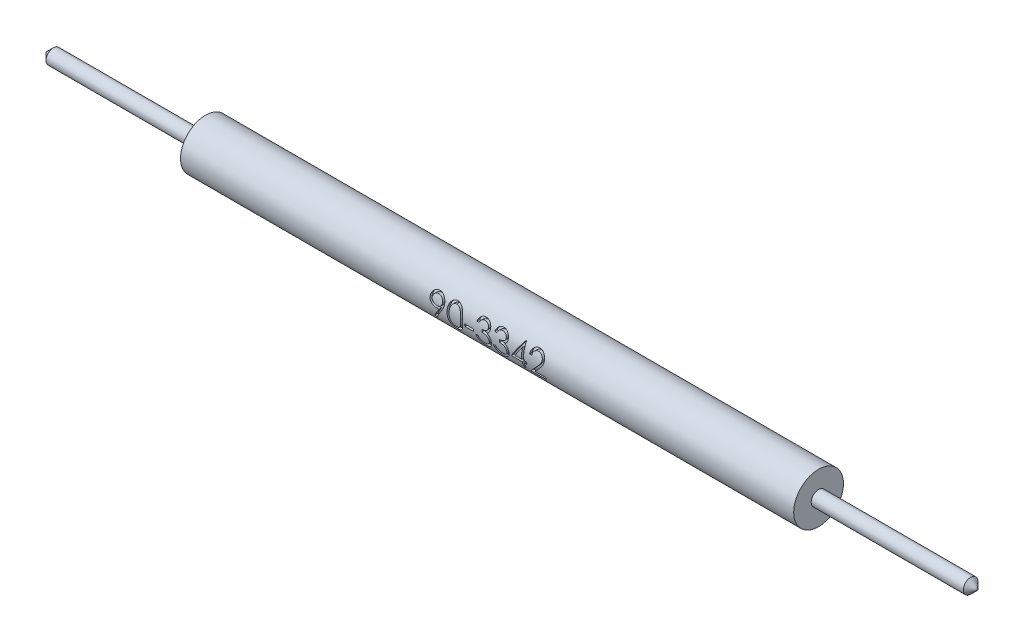
from build123d import *

# Parameters (mm, degrees)
CHAFL_N1_SIZE              = 0.762
CORTAR_EXTRUIR1_DEPTH      = 97.58883786
CORTAR_EXTRUIR1_DEPTH_BACK = 97.58883786
CROQUIS2_W                 = 25.4
CROQUIS2_H                 = 0.7366
ELIMINAR_START             = 35.56
ELIMINAR_CARA1_DEPTH       = 25.4
CORTAR_EXTRUIR2_REACH      = 104.939
CORTAR_EXTRUIR2_END_RADIUS = 2.3241
CORTAR_EXTRUIR2_START      = 6.35
CROQUIS3_W                 = 0.915865385
CROQUIS3_H                 = 0.244230769


# Read off the part's stored shape, not the designer's step: Eliminar cara1
with BuildPart() as part:
    # Croquis1 → Revolución1 (revolve)
    with BuildSketch(Plane.XY):
        Polygon((0, 0), (0, 0.762), (16.51, 0.762), (16.51, 2.5781), (80.01, 2.5781), (80.01, 0.762), (96.52, 0.762), (96.52, 0), align=None)
    revolve(axis=Axis((0, 0, 0), (-1, 0, 0)))

    # Chaflán1
    chafl_n1_edges = [part.edges().sort_by_distance(p)[0] for p in [
        (96.52, -0.762, 0),
        (0, -0.762, 0),
    ]]
    chamfer(chafl_n1_edges, length=CHAFL_N1_SIZE - 0.0001)  # a hair under: the kernel refuses the full size

    # Croquis2 → Cortar-Extruir1 (cut, two sides: drawn at the far end of the back side and taken through both)
    with BuildSketch(Plane(origin=(0, 0, 0), x_dir=(1, 0, 0), z_dir=(0, 1, 0)).offset(-CORTAR_EXTRUIR1_DEPTH_BACK)):
        with Locations((48.26, -2.2098)):
            Rectangle(CROQUIS2_W, CROQUIS2_H)
    extrude(amount=CORTAR_EXTRUIR1_DEPTH + CORTAR_EXTRUIR1_DEPTH_BACK, mode=Mode.SUBTRACT)

    # Eliminar cara1 outline → Eliminar cara1 (add)
    with BuildSketch(Plane.YZ.offset(ELIMINAR_START)):
        with BuildLine():
            Line((-1.804294145, 1.8415), (1.804294145, 1.8415))
            ThreePointArc((1.804294145, 1.8415), (0, 2.5781), (-1.804294145, 1.8415))
        make_face()
    extrude(amount=ELIMINAR_CARA1_DEPTH)

    # Cortar-Extruir2: up to this cylinder (the profile starts outside it)
    cortar_extruir2_end = Plane(origin=(47.7254675, 0, 0), z_dir=(1, 0, 0)) * Cylinder(CORTAR_EXTRUIR2_END_RADIUS, 225.532073, mode=Mode.PRIVATE)
    # Croquis3 → Cortar-Extruir2 (cut, up to the surface)
    with BuildSketch(Plane.XY.offset(CORTAR_EXTRUIR2_START), mode=Mode.PRIVATE) as cortar_extruir2_sk1:
        with BuildLine():
            Line((42.791264239, -1.230066931), (42.620493506, -1.111290639))
            Line((42.620493506, -1.111290639), (43.282587857, -0.143430814))
            add(Edge.make_bspline(
                [(43.282587857, -0.143430814), (43.240343981, -0.148596808), (43.157163435, -0.15876894), (43.073386229, -0.160637646), (43.032155916, -0.161557316)],
                knots=[0, 0, 0, 0, 1.015715272, 2, 2, 2, 2], degree=3))
            add(Edge.make_bspline(
                [(43.032155916, -0.161557316), (43.007158201, -0.160917048), (42.958089873, -0.159660258), (42.885950481, -0.149698599), (42.816631912, -0.134356458), (42.75031794, -0.111463287), (42.686759312, -0.08301197), (42.626094782, -0.04773068), (42.568406014, -0.006224614), (42.51431258, 0.04128676), (42.465114772, 0.093455221), (42.421283921, 0.148670042), (42.384856829, 0.207572622), (42.354596867, 0.268961397), (42.331648112, 0.333718709), (42.314936814, 0.401107676), (42.304648212, 0.471600596), (42.303424184, 0.519582873), (42.302802701, 0.543945238)],
                knots=[0, 0, 0, 0, 1.060718605, 2.082097864, 3.085795603, 4.069760067, 5.054557537, 6.03741023, 7.043284206, 8.066802108, 9.088538119, 10.083643548, 11.053783639, 12.022749082, 12.983451788, 13.964007469, 14.966251758, 16, 16, 16, 16], degree=3))
            add(Edge.make_bspline(
                [(42.302802701, 0.543945238), (42.303982736, 0.577261411), (42.306298905, 0.642654299), (42.324939682, 0.738199417), (42.355596806, 0.828541691), (42.398342541, 0.91344359), (42.452182414, 0.991683804), (42.516890222, 1.062174661), (42.592072384, 1.123913571), (42.676016222, 1.176984202), (42.766743902, 1.219666405), (42.861768471, 1.251125644), (42.960361828, 1.269630506), (43.027150903, 1.272070172), (43.060776709, 1.273298453)],
                knots=[0, 0, 0, 0, 1.022988612, 2.007919123, 2.978103895, 3.94594894, 4.918897164, 5.887013414, 6.875921846, 7.89917871, 8.930658928, 9.948724884, 10.967259574, 12, 12, 12, 12], degree=3))
            add(Edge.make_bspline(
                [(43.060776709, 1.273298453), (43.093766152, 1.272053289), (43.158950181, 1.269592961), (43.254805023, 1.251574404), (43.346613108, 1.221205524), (43.4338655, 1.179237991), (43.514650708, 1.126632159), (43.587296393, 1.063947778), (43.650144751, 0.991145803), (43.703092784, 0.909987027), (43.745594723, 0.822787705), (43.776259972, 0.731766858), (43.795136916, 0.637579085), (43.797515667, 0.573765345), (43.798716162, 0.541560172)],
                knots=[0, 0, 0, 0, 1.026385292, 2.028040595, 3.023318987, 4.028184125, 5.03290303, 6.015178782, 7.004435299, 8.016004309, 9.023023918, 10.015172535, 10.998308025, 12, 12, 12, 12], degree=3))
            add(Edge.make_bspline(
                [(43.798716162, 0.541560172), (43.797914423, 0.516561288), (43.796288296, 0.465857304), (43.78490163, 0.388820231), (43.765565754, 0.310272163), (43.743623081, 0.243786577), (43.722442088, 0.188876007), (43.702506854, 0.145502164), (43.680386978, 0.09984934), (43.654588675, 0.05239624), (43.626855755, 0.002537944), (43.595518998, -0.049225475), (43.561293242, -0.102963479), (43.536916237, -0.139190516), (43.52443356, -0.15774121)],
                knots=[0, 0, 0, 0, 1.179839688, 2.393009684, 3.667231171, 4.993948276, 5.694988576, 6.444077775, 7.246288328, 8.089075292, 8.993003841, 9.939041771, 10.944649915, 12, 12, 12, 12], degree=3))
            Line((43.52443356, -0.15774121), (42.791264239, -1.230066931))
        make_face()
        with BuildLine():
            add(Edge.make_bspline(
                [(43.071748013, 0.082673453), (43.090685084, 0.083190786), (43.127549122, 0.084197856), (43.181554034, 0.090327358), (43.232529251, 0.101195374), (43.28061094, 0.116788964), (43.326281207, 0.135605376), (43.368814638, 0.159562102), (43.408246828, 0.18814842), (43.444841829, 0.220268091), (43.477338407, 0.255953221), (43.506282862, 0.293302859), (43.530884962, 0.33248096), (43.550318192, 0.373978162), (43.56629609, 0.416784334), (43.577330131, 0.461588815), (43.583442686, 0.508158173), (43.584484704, 0.539793867), (43.585014239, 0.555870569)],
                knots=[0, 0, 0, 0, 1.163407946, 2.26475976, 3.333800367, 4.359385343, 5.366239384, 6.363380779, 7.350133999, 8.353570782, 9.349036268, 10.310270964, 11.253520213, 12.184142, 13.120487599, 14.056272588, 15.012232024, 16, 16, 16, 16], degree=3))
            add(Edge.make_bspline(
                [(43.585014239, 0.555870569), (43.584558625, 0.571953984), (43.583660781, 0.603648326), (43.576457636, 0.650286631), (43.563785833, 0.69498151), (43.546783378, 0.737977653), (43.524385859, 0.778921799), (43.49750938, 0.818327997), (43.465578553, 0.855946391), (43.428837521, 0.890892244), (43.389217227, 0.923105726), (43.346993922, 0.951535181), (43.302515631, 0.975362102), (43.256053709, 0.995023723), (43.20751135, 1.010366985), (43.156917279, 1.021400584), (43.104015834, 1.027504582), (43.068105709, 1.028540014), (43.049805405, 1.029067684)],
                knots=[0, 0, 0, 0, 0.972161553, 1.915763587, 2.844109794, 3.775983486, 4.705125789, 5.659731448, 6.655561913, 7.682237399, 8.721216875, 9.739758359, 10.754845918, 11.767244016, 12.7857855, 13.828538656, 14.893392813, 16, 16, 16, 16], degree=3))
            add(Edge.make_bspline(
                [(43.049805405, 1.029067684), (43.031664258, 1.028539161), (42.996071476, 1.027502203), (42.943640325, 1.021412187), (42.893388352, 1.010292781), (42.844986642, 0.99503083), (42.7985261, 0.975360636), (42.754049907, 0.951533933), (42.711816726, 0.92311227), (42.672234418, 0.890866898), (42.63542851, 0.856109053), (42.604046677, 0.818163202), (42.57710869, 0.778942297), (42.554741947, 0.737972205), (42.537731306, 0.694982964), (42.525061694, 0.650286237), (42.51785796, 0.603648429), (42.516960197, 0.571954018), (42.516504624, 0.555870569)],
                knots=[0, 0, 0, 0, 1.099389452, 2.15699305, 3.192601482, 4.213358962, 5.227959689, 6.245255729, 7.266013209, 8.307253147, 9.336162325, 10.327954924, 11.284637477, 12.215801273, 13.149702402, 14.080068371, 15.025723358, 16, 16, 16, 16], degree=3))
            add(Edge.make_bspline(
                [(42.516504624, 0.555870569), (42.51691687, 0.539781348), (42.517729895, 0.508050459), (42.525572909, 0.461428038), (42.538689024, 0.416736606), (42.556255431, 0.373541611), (42.579388656, 0.332263079), (42.607775774, 0.293096713), (42.641049011, 0.255598523), (42.678763581, 0.220351116), (42.720039597, 0.187998654), (42.764124526, 0.159743162), (42.810259433, 0.135881374), (42.858606721, 0.116735182), (42.908808098, 0.101351176), (42.96131475, 0.090347389), (43.015953033, 0.08425665), (43.052971252, 0.083206249), (43.071748013, 0.082673453)],
                knots=[0, 0, 0, 0, 0.952633368, 1.87876736, 2.791047057, 3.707742249, 4.635551637, 5.587206343, 6.568248508, 7.601284464, 8.641511608, 9.671105535, 10.699146789, 11.713763218, 12.747829548, 13.806491675, 14.887386225, 16, 16, 16, 16], degree=3))
        make_face(mode=Mode.SUBTRACT)
    cortar_extruir2_tool1 = extrude(cortar_extruir2_sk1.sketch, amount=-CORTAR_EXTRUIR2_REACH, mode=Mode.PRIVATE) - cortar_extruir2_end
    add(cortar_extruir2_tool1.solids().sort_by_distance((42.722531, -1.146738, 6.35))[0], mode=Mode.SUBTRACT)
    # Croquis3 → Cortar-Extruir2 (cut, up to the surface)
    with BuildSketch(Plane.XY.offset(CORTAR_EXTRUIR2_START), mode=Mode.PRIVATE) as cortar_extruir2_sk2:
        with BuildLine():
            add(Edge.make_bspline(
                [(44.104004624, 0.020661735), (44.104227793, 0.058827993), (44.104661303, 0.1329665), (44.109483961, 0.240996766), (44.117495399, 0.342342962), (44.128474576, 0.437009941), (44.141835416, 0.525022142), (44.15967131, 0.60614436), (44.179954663, 0.680752057), (44.203462666, 0.749088522), (44.229988287, 0.812074424), (44.25885874, 0.870874427), (44.291219787, 0.925399563), (44.325221937, 0.976520095), (44.362241578, 1.023399216), (44.40122522, 1.066698956), (44.443694389, 1.105418592), (44.4882054, 1.140692594), (44.535161245, 1.171614466), (44.583223487, 1.198851026), (44.632722943, 1.22211915), (44.683794757, 1.24041425), (44.73597989, 1.255525558), (44.789460769, 1.265859467), (44.844325697, 1.272361578), (44.881358513, 1.272983199), (44.90013969, 1.273298453)],
                knots=[0, 0, 0, 0, 1.646270934, 3.197905019, 4.663502075, 6.030701355, 7.308322542, 8.50163776, 9.611534131, 10.641858119, 11.616356847, 12.558055219, 13.465016945, 14.349605745, 15.204443733, 16.039544428, 16.859896111, 17.680448484, 18.487036065, 19.28249412, 20.06191084, 20.843045899, 21.620316918, 22.403196591, 23.190181807, 24, 24, 24, 24], degree=3))
            add(Edge.make_bspline(
                [(44.90013969, 1.273298453), (44.919077756, 1.272966565), (44.956739613, 1.272306543), (45.012420296, 1.265962932), (45.066814633, 1.255437043), (45.119690724, 1.240522951), (45.171482903, 1.222020178), (45.221786066, 1.198828765), (45.270912669, 1.171832964), (45.318082026, 1.140112076), (45.363811969, 1.104745563), (45.406979244, 1.064765962), (45.447587779, 1.020576956), (45.486147228, 0.972651331), (45.521563626, 0.920069871), (45.555291264, 0.863747111), (45.585480096, 0.802698076), (45.614554937, 0.737941365), (45.639651262, 0.667685197), (45.66228419, 0.592325601), (45.680571488, 0.510972449), (45.695804189, 0.424052575), (45.707604913, 0.331246769), (45.716199622, 0.232753973), (45.720739703, 0.128509385), (45.721594708, 0.057236635), (45.72203347, 0.020661735)],
                knots=[0, 0, 0, 0, 0.810914788, 1.612654377, 2.396697861, 3.181598691, 3.963628158, 4.749916497, 5.551656086, 6.361998678, 7.18212741, 8.025565596, 8.878627764, 9.750805457, 10.657531673, 11.591944965, 12.560506719, 13.57287815, 14.630710178, 15.753379473, 16.941251878, 18.199788006, 19.531962791, 20.947069417, 22.433333509, 24, 24, 24, 24], degree=3))
            add(Edge.make_bspline(
                [(45.72203347, 0.020661735), (45.72159016, -0.015753639), (45.720726388, -0.086707508), (45.716250518, -0.190483046), (45.70743402, -0.288453144), (45.696405439, -0.380852762), (45.681130766, -0.467297321), (45.662349394, -0.548085954), (45.641496228, -0.623567546), (45.615755056, -0.69312373), (45.587580983, -0.757724813), (45.556927358, -0.818050141), (45.524086638, -0.874632922), (45.488307509, -0.92702025), (45.450171169, -0.975583229), (45.408861388, -1.019464647), (45.36554265, -1.059721837), (45.319678132, -1.095543747), (45.27177313, -1.126897873), (45.222815258, -1.154938011), (45.171935849, -1.177548112), (45.120287929, -1.196962131), (45.067132737, -1.211794225), (45.012536532, -1.22204983), (44.956777022, -1.229242462), (44.919084171, -1.229791157), (44.90013969, -1.230066931)],
                knots=[0, 0, 0, 0, 1.561518951, 3.042555995, 4.452378317, 5.7783523, 7.031515105, 8.214008947, 9.334062868, 10.386615937, 11.391082383, 12.354592575, 13.286541444, 14.194233754, 15.072674879, 15.931287219, 16.775624067, 17.606195743, 18.42308326, 19.229000347, 20.022332153, 20.807536673, 21.593273796, 22.3848459, 23.188221202, 24, 24, 24, 24], degree=3))
            add(Edge.make_bspline(
                [(44.90013969, -1.230066931), (44.881359034, -1.229749643), (44.844327246, -1.229124013), (44.789454792, -1.222651277), (44.736194772, -1.212244872), (44.68428437, -1.197673933), (44.633457259, -1.179838482), (44.584406035, -1.156601779), (44.536585308, -1.129840564), (44.49012266, -1.099363679), (44.445891172, -1.064446606), (44.403641942, -1.025826616), (44.364436349, -0.982539974), (44.327946008, -0.935270173), (44.293265423, -0.884452092), (44.261363903, -0.829391895), (44.231856233, -0.770307905), (44.204884501, -0.706818398), (44.180970857, -0.63799692), (44.159847327, -0.56305614), (44.143168945, -0.481334609), (44.128893041, -0.393488686), (44.117378416, -0.299140887), (44.109517348, -0.198239991), (44.104658704, -0.090848876), (44.104226629, -0.017186762), (44.104004624, 0.020661735)],
                knots=[0, 0, 0, 0, 0.810891512, 1.598919785, 2.382837074, 3.152667961, 3.926044502, 4.706494248, 5.493654104, 6.291793342, 7.103789334, 7.925228297, 8.761435821, 9.622817696, 10.50288917, 11.416980706, 12.369136599, 13.353924996, 14.394355917, 15.514179734, 16.714354668, 17.994756427, 19.357759367, 20.818452758, 22.365282078, 24, 24, 24, 24], degree=3))
        make_face()
        with BuildLine():
            add(Edge.make_bspline(
                [(44.317706547, 0.021615761), (44.317787814, -0.01019005), (44.317945536, -0.071918884), (44.322065915, -0.161619389), (44.32767902, -0.24528313), (44.334918902, -0.32301634), (44.345670551, -0.394555902), (44.357717491, -0.460393847), (44.372377887, -0.520181753), (44.389723605, -0.574329888), (44.409480562, -0.623757201), (44.431051873, -0.669750171), (44.454225329, -0.712852113), (44.480159965, -0.752675872), (44.508405035, -0.789351315), (44.538322556, -0.823527582), (44.571029082, -0.854005528), (44.616275378, -0.890558978), (44.676008337, -0.928331817), (44.751269754, -0.961224424), (44.828604896, -0.981895346), (44.8810953, -0.984524079), (44.907294888, -0.985836162)],
                knots=[0, 0, 0, 0, 1.459021318, 2.831673884, 4.118529203, 5.306027144, 6.411944654, 7.436330062, 8.375795394, 9.233974572, 10.042671642, 10.816086306, 11.563610507, 12.285937304, 12.993564865, 13.685989202, 14.367179055, 15.041617293, 16.353048772, 17.594441528, 18.799311195, 20, 20, 20, 20], degree=3))
            add(Edge.make_bspline(
                [(44.907294888, -0.985836162), (44.933663947, -0.9847491), (44.986347622, -0.982577222), (45.063319008, -0.961623081), (45.138042817, -0.930007198), (45.196602476, -0.89262327), (45.241153992, -0.857021317), (45.273074301, -0.826667422), (45.302371874, -0.792679591), (45.330159071, -0.75600882), (45.355644621, -0.715954505), (45.37881972, -0.672709253), (45.399967497, -0.626152973), (45.412015973, -0.59365249), (45.418176048, -0.577035832)],
                knots=[0, 0, 0, 0, 1.353760809, 2.704726607, 4.075137775, 5.516104923, 6.260822281, 7.007110065, 7.778089737, 8.566572457, 9.372053459, 10.217411131, 11.088608312, 12, 12, 12, 12], degree=3))
            add(Edge.make_bspline(
                [(45.418176048, -0.577035832), (45.425355019, -0.555788455), (45.439931408, -0.512647169), (45.458717276, -0.445724756), (45.473511913, -0.375510018), (45.486821989, -0.302422573), (45.495906836, -0.225923419), (45.503219187, -0.146249254), (45.507526315, -0.063340006), (45.508060226, -0.007009842), (45.508331547, 0.021615761)],
                knots=[0, 0, 0, 0, 0.884706709, 1.796334032, 2.740027952, 3.714592787, 4.726048262, 5.777819803, 6.87074269, 8, 8, 8, 8], degree=3))
            add(Edge.make_bspline(
                [(45.508331547, 0.021615761), (45.507957222, 0.050236734), (45.507224962, 0.106225477), (45.504425981, 0.188220882), (45.497198156, 0.266099841), (45.489170541, 0.340197859), (45.477334217, 0.410104761), (45.46457221, 0.476405772), (45.447426385, 0.538279509), (45.429111324, 0.596694689), (45.408149251, 0.650987634), (45.385074439, 0.701411478), (45.360430707, 0.748209657), (45.333663932, 0.791253772), (45.305091869, 0.830736627), (45.273960394, 0.865866593), (45.241504383, 0.897732458), (45.196044833, 0.934106099), (45.136531076, 0.971193521), (45.062477162, 1.005324154), (44.98541267, 1.024924081), (44.933315374, 1.027687479), (44.907294888, 1.029067684)],
                knots=[0, 0, 0, 0, 1.31362396, 2.569729283, 3.763502607, 4.902122613, 5.988968491, 7.01645872, 7.998833611, 8.933434873, 9.825090667, 10.667526885, 11.477055099, 12.250526234, 12.991942729, 13.710640831, 14.402115721, 15.076753259, 16.378508321, 17.609869233, 18.806226677, 20, 20, 20, 20], degree=3))
            add(Edge.make_bspline(
                [(44.907294888, 1.029067684), (44.88095786, 1.027685575), (44.828235825, 1.024918838), (44.750370341, 1.005397178), (44.675732202, 0.9713705), (44.616375821, 0.933983261), (44.570884566, 0.898374517), (44.53885152, 0.867495518), (44.508816356, 0.833718335), (44.481147796, 0.796705603), (44.45523348, 0.756928273), (44.431433898, 0.714073417), (44.409990858, 0.667923864), (44.390202986, 0.618518753), (44.372804357, 0.564375289), (44.358452928, 0.504661028), (44.345194773, 0.439032491), (44.335809063, 0.367105468), (44.327465329, 0.289352789), (44.322103198, 0.205480185), (44.317931753, 0.11562924), (44.317783119, 0.053581241), (44.317706547, 0.021615761)],
                knots=[0, 0, 0, 0, 1.207732386, 2.417664972, 3.655092373, 4.956220595, 5.625982001, 6.301752483, 6.994047911, 7.697131622, 8.419323945, 9.170223765, 9.943494443, 10.752040957, 11.610060368, 12.549350801, 13.567764191, 14.679664412, 15.874934091, 17.154273443, 18.533957287, 20, 20, 20, 20], degree=3))
        make_face(mode=Mode.SUBTRACT)
    cortar_extruir2_tool2 = extrude(cortar_extruir2_sk2.sketch, amount=-CORTAR_EXTRUIR2_REACH, mode=Mode.PRIVATE) - cortar_extruir2_end
    add(cortar_extruir2_tool2.solids().sort_by_distance((44.269087, 0.823648, 6.35))[0], mode=Mode.SUBTRACT)
    # Croquis3 → Cortar-Extruir2 (cut, up to the surface)
    with BuildSketch(Plane.XY.offset(CORTAR_EXTRUIR2_START), mode=Mode.PRIVATE) as cortar_extruir2_sk3:
        with Locations((46.393668086, -0.253143854)):
            Rectangle(CROQUIS3_W, CROQUIS3_H)
    cortar_extruir2_tool3 = extrude(cortar_extruir2_sk3.sketch, amount=-CORTAR_EXTRUIR2_REACH, mode=Mode.PRIVATE) - cortar_extruir2_end
    add(cortar_extruir2_tool3.solids().sort_by_distance((46.393668, -0.253144, 6.35))[0], mode=Mode.SUBTRACT)
    # Croquis3 → Cortar-Extruir2 (cut, up to the surface)
    with BuildSketch(Plane.XY.offset(CORTAR_EXTRUIR2_START), mode=Mode.PRIVATE) as cortar_extruir2_sk4:
        with BuildLine():
            Line((47.340062316, 0.66272153), (47.126360393, 0.66272153))
            add(Edge.make_bspline(
                [(47.126360393, 0.66272153), (47.132149927, 0.686692202), (47.143467991, 0.733552906), (47.167074733, 0.800504989), (47.192791726, 0.863862242), (47.223672528, 0.92243832), (47.257356162, 0.977410431), (47.295947871, 1.027531746), (47.337667182, 1.074076996), (47.383812371, 1.11538368), (47.432205264, 1.152788171), (47.483527747, 1.184679951), (47.536747251, 1.212114777), (47.592232508, 1.234716399), (47.650148707, 1.251742693), (47.709972254, 1.264095805), (47.771859921, 1.272117974), (47.813870335, 1.272900904), (47.83520204, 1.273298453)],
                knots=[0, 0, 0, 0, 1.162005537, 2.271625781, 3.343758855, 4.383309926, 5.390229558, 6.379919256, 7.361854164, 8.333198761, 9.295911338, 10.242430842, 11.177959212, 12.116337295, 13.062827104, 14.020064771, 14.994644689, 16, 16, 16, 16], degree=3))
            add(Edge.make_bspline(
                [(47.83520204, 1.273298453), (47.86628262, 1.272360084), (47.927765822, 1.270503814), (48.018092109, 1.2535531), (48.10519607, 1.226729929), (48.18812429, 1.18966834), (48.265153259, 1.143956971), (48.333689844, 1.089552391), (48.392805063, 1.027504295), (48.442399273, 0.958970176), (48.481230656, 0.885725981), (48.509864421, 0.810342303), (48.527296315, 0.732997961), (48.529555479, 0.680775598), (48.530687316, 0.654612305)],
                knots=[0, 0, 0, 0, 1.083050992, 2.142477498, 3.193116406, 4.255571735, 5.30263384, 6.308962982, 7.297363603, 8.282367274, 9.249857812, 10.179914175, 11.08814088, 12, 12, 12, 12], degree=3))
            add(Edge.make_bspline(
                [(48.530687316, 0.654612305), (48.529895659, 0.629434468), (48.528346508, 0.580165348), (48.515192683, 0.508236973), (48.493056404, 0.440445098), (48.462392869, 0.376504343), (48.422699779, 0.316820122), (48.374617105, 0.26125815), (48.317805472, 0.20957199), (48.274753195, 0.179963206), (48.252588608, 0.164719727)],
                knots=[0, 0, 0, 0, 1.024540389, 2.004866551, 2.965041327, 3.920577974, 4.882998113, 5.874504559, 6.905732034, 8, 8, 8, 8], degree=3))
            add(Edge.make_bspline(
                [(48.252588608, 0.164719727), (48.277919498, 0.15248815), (48.328107318, 0.128253857), (48.396517589, 0.080726994), (48.458619144, 0.025851872), (48.493251852, -0.016971612), (48.510652761, -0.038487905)],
                knots=[0, 0, 0, 0, 1.015518401, 2.012035669, 3.001164323, 4, 4, 4, 4], degree=3))
            add(Edge.make_bspline(
                [(48.510652761, -0.038487905), (48.522110888, -0.054175411), (48.544839509, -0.085293529), (48.572894399, -0.135324562), (48.598345957, -0.185910129), (48.618178517, -0.238406082), (48.633536808, -0.292203971), (48.644515073, -0.347396173), (48.651335069, -0.404027756), (48.652311757, -0.442340354), (48.652802701, -0.461598632)],
                knots=[0, 0, 0, 0, 1.025084078, 2.033381695, 3.024893161, 4.013698104, 4.991890475, 5.976764909, 6.982997093, 8, 8, 8, 8], degree=3))
            add(Edge.make_bspline(
                [(48.652802701, -0.461598632), (48.651581791, -0.494942746), (48.649145716, -0.561474056), (48.627371515, -0.659768465), (48.593616793, -0.755852244), (48.545680913, -0.847751375), (48.48726034, -0.93373517), (48.417756875, -1.010667445), (48.337960229, -1.07679721), (48.248965672, -1.132049168), (48.152547411, -1.17621654), (48.049421874, -1.206871694), (47.941074963, -1.226837454), (47.866774998, -1.228978449), (47.829000868, -1.230066931)],
                knots=[0, 0, 0, 0, 0.955779014, 1.907060117, 2.875433937, 3.871313158, 4.872415639, 5.851225146, 6.836215519, 7.83643374, 8.849228613, 9.86973379, 10.916971861, 12, 12, 12, 12], degree=3))
            add(Edge.make_bspline(
                [(47.829000868, -1.230066931), (47.80354238, -1.229476236), (47.753448564, -1.228313945), (47.679804327, -1.220368326), (47.609508671, -1.205856304), (47.542466551, -1.186327805), (47.478618411, -1.161568424), (47.418159082, -1.130735524), (47.360716601, -1.094464662), (47.306833029, -1.052327704), (47.256514789, -1.005191649), (47.211099096, -0.952219716), (47.169828773, -0.894391125), (47.13380887, -0.831034188), (47.101398729, -0.762967683), (47.074741686, -0.689320044), (47.051279183, -0.610749665), (47.040370701, -0.555996059), (47.034773855, -0.52790347)],
                knots=[0, 0, 0, 0, 1.048658725, 2.063410685, 3.046034179, 4.001477787, 4.936774919, 5.862367409, 6.792675028, 7.730719943, 8.675894397, 9.627829632, 10.600096036, 11.597688215, 12.626045268, 13.701542398, 14.82072376, 16, 16, 16, 16], degree=3))
            Line((47.034773855, -0.52790347), (47.248475778, -0.52790347))
            add(Edge.make_bspline(
                [(47.248475778, -0.52790347), (47.254043338, -0.546238423), (47.264872728, -0.581901501), (47.283306527, -0.633227852), (47.304307976, -0.680280027), (47.326837703, -0.723403187), (47.350499467, -0.763022018), (47.376975514, -0.798088897), (47.404304879, -0.830144061), (47.424905653, -0.848203877), (47.434987947, -0.857042592)],
                knots=[0, 0, 0, 0, 1.198163088, 2.33053128, 3.407730985, 4.417276592, 5.372219308, 6.28897303, 7.162600585, 8, 8, 8, 8], degree=3))
            add(Edge.make_bspline(
                [(47.434987947, -0.857042592), (47.448320618, -0.867321655), (47.474944805, -0.887848052), (47.518329976, -0.91404291), (47.56395805, -0.936740322), (47.612817677, -0.954078336), (47.663854512, -0.968758852), (47.717893487, -0.978365848), (47.774457847, -0.984957264), (47.813080201, -0.985538923), (47.832816974, -0.985836162)],
                knots=[0, 0, 0, 0, 0.946170439, 1.889420265, 2.845303464, 3.807233317, 4.801018734, 5.828864929, 6.890507805, 8, 8, 8, 8], degree=3))
            add(Edge.make_bspline(
                [(47.832816974, -0.985836162), (47.855101053, -0.985417127), (47.898675647, -0.984597739), (47.962258328, -0.977062302), (48.022747145, -0.96608786), (48.07947051, -0.949138135), (48.133171445, -0.928196162), (48.183097174, -0.901901444), (48.229903097, -0.871050839), (48.27298971, -0.835985804), (48.311732993, -0.797599037), (48.345845769, -0.757449072), (48.374845762, -0.715705195), (48.398238875, -0.672136402), (48.416710945, -0.626923113), (48.429286123, -0.579938445), (48.438029743, -0.531566912), (48.438741813, -0.498685953), (48.439100778, -0.482110201)],
                knots=[0, 0, 0, 0, 1.217147791, 2.380027433, 3.494444702, 4.572153297, 5.609568379, 6.639424714, 7.649109417, 8.668170816, 9.669597737, 10.625200337, 11.543417969, 12.441394052, 13.322311151, 14.205496177, 15.095365482, 16, 16, 16, 16], degree=3))
            add(Edge.make_bspline(
                [(48.439100778, -0.482110201), (48.438059626, -0.459922843), (48.435982504, -0.41565853), (48.420124345, -0.350536394), (48.394040225, -0.287791537), (48.357523748, -0.228494473), (48.313072119, -0.173538011), (48.261116709, -0.124503663), (48.201226075, -0.084042762), (48.146103628, -0.056087801), (48.097277692, -0.037012577), (48.055493296, -0.024306931), (48.00871425, -0.013547998), (47.957506252, -0.003538399), (47.901483456, 0.00498059), (47.840706855, 0.012084754), (47.775164131, 0.017769166), (47.72979032, 0.020307643), (47.70640847, 0.021615761)],
                knots=[0, 0, 0, 0, 1.07054697, 2.135767047, 3.216561865, 4.33974944, 5.486079747, 6.621378074, 7.775625952, 8.963672916, 9.598146892, 10.304877434, 11.070270905, 11.915000392, 12.823868403, 13.805723172, 14.86925407, 16, 16, 16, 16], degree=3))
            Line((47.70640847, 0.021615761), (47.70640847, 0.26584653))
            add(Edge.make_bspline(
                [(47.70640847, 0.26584653), (47.735868727, 0.266346459), (47.793574135, 0.267325697), (47.87786651, 0.279169361), (47.958470674, 0.295552789), (48.033600297, 0.320647893), (48.102077368, 0.349794595), (48.161485883, 0.383711902), (48.210993531, 0.421413722), (48.250359724, 0.463481979), (48.279975146, 0.508599896), (48.301628735, 0.555623907), (48.314419671, 0.60496617), (48.316127141, 0.638640221), (48.316985393, 0.655566332)],
                knots=[0, 0, 0, 0, 1.321986639, 2.589447074, 3.816329219, 5.01088745, 6.139805852, 7.153945165, 8.075214402, 8.924034688, 9.728124013, 10.488707548, 11.240355623, 12, 12, 12, 12], degree=3))
            add(Edge.make_bspline(
                [(48.316985393, 0.655566332), (48.316703446, 0.668001726), (48.316142524, 0.692741354), (48.309068662, 0.728885374), (48.298438734, 0.76392441), (48.283824847, 0.797709456), (48.264264444, 0.830006196), (48.240856085, 0.861089978), (48.212983146, 0.890783335), (48.181043476, 0.918460481), (48.146745444, 0.944837409), (48.109155865, 0.967230437), (48.069408125, 0.986379131), (48.027458219, 1.002169881), (47.98317001, 1.014048433), (47.936751584, 1.022577282), (47.888114428, 1.027909686), (47.854932232, 1.028677412), (47.838064119, 1.029067684)],
                knots=[0, 0, 0, 0, 0.884392785, 1.759457502, 2.611959086, 3.489218968, 4.37281399, 5.2945488, 6.255912374, 7.266815255, 8.301784654, 9.332968512, 10.37626691, 11.440494194, 12.520033166, 13.637162961, 14.798855837, 16, 16, 16, 16], degree=3))
            add(Edge.make_bspline(
                [(47.838064119, 1.029067684), (47.810950752, 1.028121061), (47.75799204, 1.026272086), (47.68164582, 1.010077536), (47.610671416, 0.984238875), (47.556420645, 0.953396232), (47.516359465, 0.922949954), (47.487732119, 0.896359974), (47.459619415, 0.866810142), (47.433870838, 0.832480426), (47.407830865, 0.795695699), (47.384124118, 0.754586016), (47.361087435, 0.71022374), (47.347206415, 0.678862246), (47.340062316, 0.66272153)],
                knots=[0, 0, 0, 0, 1.472543308, 2.876219568, 4.221790263, 5.565193594, 6.249813518, 6.953379497, 7.687249741, 8.463570142, 9.283606569, 10.136032583, 11.040678096, 12, 12, 12, 12], degree=3))
        make_face()
    cortar_extruir2_tool4 = extrude(cortar_extruir2_sk4.sketch, amount=-CORTAR_EXTRUIR2_REACH, mode=Mode.PRIVATE) - cortar_extruir2_end
    add(cortar_extruir2_tool4.solids().sort_by_distance((47.977171, 0.001913, 6.35))[0], mode=Mode.SUBTRACT)
    # Croquis3 → Cortar-Extruir2 (cut, up to the surface)
    with BuildSketch(Plane.XY.offset(CORTAR_EXTRUIR2_START), mode=Mode.PRIVATE) as cortar_extruir2_sk5:
        with BuildLine():
            Line((49.171793085, 0.66272153), (48.958091162, 0.66272153))
            add(Edge.make_bspline(
                [(48.958091162, 0.66272153), (48.963880696, 0.686692202), (48.97519876, 0.733552906), (48.998805502, 0.800504989), (49.024522496, 0.863862242), (49.055403297, 0.92243832), (49.089086932, 0.977410431), (49.12767864, 1.027531746), (49.169397952, 1.074076996), (49.21554314, 1.11538368), (49.263936033, 1.152788171), (49.315258516, 1.184679951), (49.36847802, 1.212114777), (49.423963277, 1.234716399), (49.481879476, 1.251742693), (49.541703023, 1.264095805), (49.60359069, 1.272117974), (49.645601104, 1.272900904), (49.666932809, 1.273298453)],
                knots=[0, 0, 0, 0, 1.162005537, 2.271625781, 3.343758855, 4.383309926, 5.390229558, 6.379919256, 7.361854164, 8.333198761, 9.295911338, 10.242430842, 11.177959212, 12.116337295, 13.062827104, 14.020064771, 14.994644689, 16, 16, 16, 16], degree=3))
            add(Edge.make_bspline(
                [(49.666932809, 1.273298453), (49.698013389, 1.272360084), (49.759496591, 1.270503814), (49.849822878, 1.2535531), (49.936926839, 1.226729929), (50.019855059, 1.18966834), (50.096884029, 1.143956971), (50.165420613, 1.089552391), (50.224535832, 1.027504295), (50.274130042, 0.958970176), (50.312961426, 0.885725981), (50.34159519, 0.810342303), (50.359027084, 0.732997961), (50.361286249, 0.680775598), (50.362418085, 0.654612305)],
                knots=[0, 0, 0, 0, 1.083050992, 2.142477498, 3.193116406, 4.255571735, 5.30263384, 6.308962982, 7.297363603, 8.282367274, 9.249857812, 10.179914175, 11.08814088, 12, 12, 12, 12], degree=3))
            add(Edge.make_bspline(
                [(50.362418085, 0.654612305), (50.361626428, 0.629434468), (50.360077277, 0.580165348), (50.346923452, 0.508236973), (50.324787173, 0.440445098), (50.294123639, 0.376504343), (50.254430548, 0.316820122), (50.206347874, 0.26125815), (50.149536242, 0.20957199), (50.106483964, 0.179963206), (50.084319377, 0.164719727)],
                knots=[0, 0, 0, 0, 1.024540389, 2.004866551, 2.965041327, 3.920577974, 4.882998113, 5.874504559, 6.905732034, 8, 8, 8, 8], degree=3))
            add(Edge.make_bspline(
                [(50.084319377, 0.164719727), (50.109650268, 0.15248815), (50.159838087, 0.128253857), (50.228248358, 0.080726994), (50.290349913, 0.025851872), (50.324982622, -0.016971612), (50.34238353, -0.038487905)],
                knots=[0, 0, 0, 0, 1.015518401, 2.012035669, 3.001164323, 4, 4, 4, 4], degree=3))
            add(Edge.make_bspline(
                [(50.34238353, -0.038487905), (50.353841658, -0.054175411), (50.376570278, -0.085293529), (50.404625168, -0.135324562), (50.430076726, -0.185910129), (50.449909286, -0.238406082), (50.465267577, -0.292203971), (50.476245842, -0.347396173), (50.483065838, -0.404027756), (50.484042526, -0.442340354), (50.48453347, -0.461598632)],
                knots=[0, 0, 0, 0, 1.025084078, 2.033381695, 3.024893161, 4.013698104, 4.991890475, 5.976764909, 6.982997093, 8, 8, 8, 8], degree=3))
            add(Edge.make_bspline(
                [(50.48453347, -0.461598632), (50.48331256, -0.494942746), (50.480876485, -0.561474056), (50.459102285, -0.659768465), (50.425347562, -0.755852244), (50.377411682, -0.847751375), (50.318991109, -0.93373517), (50.249487644, -1.010667445), (50.169690998, -1.07679721), (50.080696441, -1.132049168), (49.98427818, -1.17621654), (49.881152644, -1.206871694), (49.772805732, -1.226837454), (49.698505767, -1.228978449), (49.660731637, -1.230066931)],
                knots=[0, 0, 0, 0, 0.955779014, 1.907060117, 2.875433937, 3.871313158, 4.872415639, 5.851225146, 6.836215519, 7.83643374, 8.849228613, 9.86973379, 10.916971861, 12, 12, 12, 12], degree=3))
            add(Edge.make_bspline(
                [(49.660731637, -1.230066931), (49.635273149, -1.229476236), (49.585179333, -1.228313945), (49.511535096, -1.220368326), (49.44123944, -1.205856304), (49.374197321, -1.186327805), (49.31034918, -1.161568424), (49.249889851, -1.130735524), (49.19244737, -1.094464662), (49.138563798, -1.052327704), (49.088245558, -1.005191649), (49.042829865, -0.952219716), (49.001559542, -0.894391125), (48.965539639, -0.831034188), (48.933129498, -0.762967683), (48.906472455, -0.689320044), (48.883009952, -0.610749665), (48.87210147, -0.555996059), (48.866504624, -0.52790347)],
                knots=[0, 0, 0, 0, 1.048658725, 2.063410685, 3.046034179, 4.001477787, 4.936774919, 5.862367409, 6.792675028, 7.730719943, 8.675894397, 9.627829632, 10.600096036, 11.597688215, 12.626045268, 13.701542398, 14.82072376, 16, 16, 16, 16], degree=3))
            Line((48.866504624, -0.52790347), (49.080206547, -0.52790347))
            add(Edge.make_bspline(
                [(49.080206547, -0.52790347), (49.085774108, -0.546238423), (49.096603497, -0.581901501), (49.115037296, -0.633227852), (49.136038746, -0.680280027), (49.158568472, -0.723403187), (49.182230236, -0.763022018), (49.208706283, -0.798088897), (49.236035648, -0.830144061), (49.256636423, -0.848203877), (49.266718716, -0.857042592)],
                knots=[0, 0, 0, 0, 1.198163088, 2.33053128, 3.407730985, 4.417276592, 5.372219308, 6.28897303, 7.162600585, 8, 8, 8, 8], degree=3))
            add(Edge.make_bspline(
                [(49.266718716, -0.857042592), (49.280051387, -0.867321655), (49.306675574, -0.887848052), (49.350060745, -0.91404291), (49.39568882, -0.936740322), (49.444548446, -0.954078336), (49.495585281, -0.968758852), (49.549624256, -0.978365848), (49.606188617, -0.984957264), (49.64481097, -0.985538923), (49.664547743, -0.985836162)],
                knots=[0, 0, 0, 0, 0.946170439, 1.889420265, 2.845303464, 3.807233317, 4.801018734, 5.828864929, 6.890507805, 8, 8, 8, 8], degree=3))
            add(Edge.make_bspline(
                [(49.664547743, -0.985836162), (49.686831822, -0.985417127), (49.730406416, -0.984597739), (49.793989097, -0.977062302), (49.854477914, -0.96608786), (49.91120128, -0.949138135), (49.964902214, -0.928196162), (50.014827944, -0.901901444), (50.061633866, -0.871050839), (50.104720479, -0.835985804), (50.143463762, -0.797599037), (50.177576538, -0.757449072), (50.206576531, -0.715705195), (50.229969644, -0.672136402), (50.248441715, -0.626923113), (50.261016892, -0.579938445), (50.269760512, -0.531566912), (50.270472582, -0.498685953), (50.270831547, -0.482110201)],
                knots=[0, 0, 0, 0, 1.217147791, 2.380027433, 3.494444702, 4.572153297, 5.609568379, 6.639424714, 7.649109417, 8.668170816, 9.669597737, 10.625200337, 11.543417969, 12.441394052, 13.322311151, 14.205496177, 15.095365482, 16, 16, 16, 16], degree=3))
            add(Edge.make_bspline(
                [(50.270831547, -0.482110201), (50.269790395, -0.459922843), (50.267713273, -0.41565853), (50.251855114, -0.350536394), (50.225770994, -0.287791537), (50.189254518, -0.228494473), (50.144802888, -0.173538011), (50.092847478, -0.124503663), (50.032956844, -0.084042762), (49.977834398, -0.056087801), (49.929008461, -0.037012577), (49.887224065, -0.024306931), (49.840445019, -0.013547998), (49.789237021, -0.003538399), (49.733214226, 0.00498059), (49.672437624, 0.012084754), (49.6068949, 0.017769166), (49.561521089, 0.020307643), (49.538139239, 0.021615761)],
                knots=[0, 0, 0, 0, 1.07054697, 2.135767047, 3.216561865, 4.33974944, 5.486079747, 6.621378074, 7.775625952, 8.963672916, 9.598146892, 10.304877434, 11.070270905, 11.915000392, 12.823868403, 13.805723172, 14.86925407, 16, 16, 16, 16], degree=3))
            Line((49.538139239, 0.021615761), (49.538139239, 0.26584653))
            add(Edge.make_bspline(
                [(49.538139239, 0.26584653), (49.567599497, 0.266346459), (49.625304904, 0.267325697), (49.709597279, 0.279169361), (49.790201443, 0.295552789), (49.865331066, 0.320647893), (49.933808137, 0.349794595), (49.993216652, 0.383711902), (50.0427243, 0.421413722), (50.082090494, 0.463481979), (50.111705915, 0.508599896), (50.133359504, 0.555623907), (50.14615044, 0.60496617), (50.14785791, 0.638640221), (50.148716162, 0.655566332)],
                knots=[0, 0, 0, 0, 1.321986639, 2.589447074, 3.816329219, 5.01088745, 6.139805852, 7.153945165, 8.075214402, 8.924034688, 9.728124013, 10.488707548, 11.240355623, 12, 12, 12, 12], degree=3))
            add(Edge.make_bspline(
                [(50.148716162, 0.655566332), (50.148434215, 0.668001726), (50.147873294, 0.692741354), (50.140799431, 0.728885374), (50.130169504, 0.76392441), (50.115555616, 0.797709456), (50.095995213, 0.830006196), (50.072586855, 0.861089978), (50.044713915, 0.890783335), (50.012774245, 0.918460481), (49.978476213, 0.944837409), (49.940886634, 0.967230437), (49.901138894, 0.986379131), (49.859188988, 1.002169881), (49.814900779, 1.014048433), (49.768482353, 1.022577282), (49.719845197, 1.027909686), (49.686663001, 1.028677412), (49.669794888, 1.029067684)],
                knots=[0, 0, 0, 0, 0.884392785, 1.759457502, 2.611959086, 3.489218968, 4.37281399, 5.2945488, 6.255912374, 7.266815255, 8.301784654, 9.332968512, 10.37626691, 11.440494194, 12.520033166, 13.637162961, 14.798855837, 16, 16, 16, 16], degree=3))
            add(Edge.make_bspline(
                [(49.669794888, 1.029067684), (49.642681521, 1.028121061), (49.589722809, 1.026272086), (49.513376589, 1.010077536), (49.442402185, 0.984238875), (49.388151414, 0.953396232), (49.348090234, 0.922949954), (49.319462888, 0.896359974), (49.291350184, 0.866810142), (49.265601607, 0.832480426), (49.239561634, 0.795695699), (49.215854888, 0.754586016), (49.192818204, 0.71022374), (49.178937184, 0.678862246), (49.171793085, 0.66272153)],
                knots=[0, 0, 0, 0, 1.472543308, 2.876219568, 4.221790263, 5.565193594, 6.249813518, 6.953379497, 7.687249741, 8.463570142, 9.283606569, 10.136032583, 11.040678096, 12, 12, 12, 12], degree=3))
        make_face()
    cortar_extruir2_tool5 = extrude(cortar_extruir2_sk5.sketch, amount=-CORTAR_EXTRUIR2_REACH, mode=Mode.PRIVATE) - cortar_extruir2_end
    add(cortar_extruir2_tool5.solids().sort_by_distance((49.808902, 0.001913, 6.35))[0], mode=Mode.SUBTRACT)
    # Croquis3 → Cortar-Extruir2 (cut, up to the surface)
    with BuildSketch(Plane.XY.offset(CORTAR_EXTRUIR2_START), mode=Mode.PRIVATE) as cortar_extruir2_sk6:
        Polygon((51.998096421, 1.273298453), (52.041504624, 1.273298453), (52.041504624, -0.375259239), (52.316264239, -0.375259239), (52.316264239, -0.619490008), (52.041504624, -0.619490008), (52.041504624, -1.169009239), (51.827802701, -1.169009239), (51.827802701, -0.619490008), (50.698235393, -0.619490008), align=None)
        Polygon((51.827802701, -0.375259239), (51.827802701, 0.658905424), (51.118007028, -0.375259239), align=None, mode=Mode.SUBTRACT)
    cortar_extruir2_tool6 = extrude(cortar_extruir2_sk6.sketch, amount=-CORTAR_EXTRUIR2_REACH, mode=Mode.PRIVATE) - cortar_extruir2_end
    add(cortar_extruir2_tool6.solids().sort_by_distance((52.019801, 1.244002, 6.35))[0], mode=Mode.SUBTRACT)
    # Croquis3 → Cortar-Extruir2 (cut, up to the surface)
    with BuildSketch(Plane.XY.offset(CORTAR_EXTRUIR2_START), mode=Mode.PRIVATE) as cortar_extruir2_sk7:
        with BuildLine():
            Line((52.835254624, 0.479548453), (52.621552701, 0.479548453))
            add(Edge.make_bspline(
                [(52.621552701, 0.479548453), (52.622945496, 0.507899539), (52.625680909, 0.563580318), (52.63849087, 0.64476319), (52.656820288, 0.722361187), (52.682736081, 0.795751254), (52.714921245, 0.865582299), (52.753517924, 0.931576953), (52.79923374, 0.993483458), (52.851081536, 1.050727921), (52.907393771, 1.103243036), (52.968153705, 1.148592407), (53.032001839, 1.186908537), (53.098744466, 1.218940596), (53.169134599, 1.242984312), (53.242533472, 1.260824392), (53.319263563, 1.271557942), (53.371542221, 1.272711682), (53.398130225, 1.273298453)],
                knots=[0, 0, 0, 0, 1.10065271, 2.161652631, 3.183658789, 4.190468796, 5.17591951, 6.163126047, 7.15150782, 8.156236427, 9.156009102, 10.134482811, 11.092018607, 12.041330605, 13.001268258, 13.972401359, 14.968799086, 16, 16, 16, 16], degree=3))
            add(Edge.make_bspline(
                [(53.398130225, 1.273298453), (53.424241022, 1.272687182), (53.475547805, 1.271486056), (53.550429282, 1.261171141), (53.621715263, 1.245015658), (53.689266404, 1.222349277), (53.752543745, 1.191879872), (53.812022637, 1.155278332), (53.868411189, 1.112946626), (53.919170447, 1.06310787), (53.965780408, 1.009902319), (54.00599105, 0.953100728), (54.040426077, 0.894434017), (54.069128766, 0.83345483), (54.090258032, 0.769589006), (54.106299634, 0.703766355), (54.115367036, 0.635305546), (54.116758654, 0.588968765), (54.117466162, 0.565410833)],
                knots=[0, 0, 0, 0, 1.111607364, 2.184268762, 3.212621178, 4.221274766, 5.211760367, 6.196651075, 7.1921475, 8.207485113, 9.220403448, 10.201281604, 11.166441695, 12.114753415, 13.065576456, 14.026450734, 14.996634279, 16, 16, 16, 16], degree=3))
            add(Edge.make_bspline(
                [(54.117466162, 0.565410833), (54.116314139, 0.532244896), (54.114030308, 0.466495036), (54.094494277, 0.36987421), (54.063982633, 0.276261544), (54.027245145, 0.20092063), (53.990184429, 0.140209985), (53.956787393, 0.090225027), (53.917690798, 0.036405056), (53.872325606, -0.021069704), (53.821630241, -0.082649444), (53.765145519, -0.148296966), (53.70246865, -0.217334009), (53.658477777, -0.26448657), (53.635682809, -0.288919846)],
                knots=[0, 0, 0, 0, 1.184426356, 2.348067706, 3.509069118, 4.696110526, 5.333549288, 6.050745305, 6.844228056, 7.710549037, 8.667450064, 9.695053472, 10.805634456, 12, 12, 12, 12], degree=3))
            Line((53.635682809, -0.288919846), (53.039893296, -0.92477847))
            Line((53.039893296, -0.92477847), (54.147995008, -0.92477847))
            Line((54.147995008, -0.92477847), (54.147995008, -1.169009239))
            Line((54.147995008, -1.169009239), (52.529966162, -1.169009239))
            Line((52.529966162, -1.169009239), (53.453463758, -0.183499924))
            add(Edge.make_bspline(
                [(53.453463758, -0.183499924), (53.475948124, -0.160028755), (53.519135989, -0.114945442), (53.580220207, -0.049125678), (53.635083519, 0.011936063), (53.684081066, 0.068124411), (53.726149933, 0.120261246), (53.763482648, 0.166657999), (53.793394952, 0.209353438), (53.825858462, 0.258843034), (53.857300475, 0.319267128), (53.88431906, 0.393108799), (53.900793805, 0.469123234), (53.90277013, 0.520491584), (53.903764239, 0.546330304)],
                knots=[0, 0, 0, 0, 1.329631726, 2.553950428, 3.673215718, 4.687767853, 5.603093632, 6.413772471, 7.123043292, 7.734684054, 8.834405432, 9.900288307, 10.943827018, 12, 12, 12, 12], degree=3))
            add(Edge.make_bspline(
                [(53.903764239, 0.546330304), (53.903331707, 0.562578184), (53.90247927, 0.594599636), (53.894956087, 0.641548197), (53.883586975, 0.686836043), (53.867295647, 0.730602479), (53.845791776, 0.772407467), (53.819616137, 0.812301896), (53.78941504, 0.850870638), (53.754477837, 0.887033864), (53.716097857, 0.92015447), (53.675552484, 0.949494249), (53.632655895, 0.974013716), (53.587588954, 0.994113845), (53.540477305, 1.009881381), (53.491229826, 1.02080695), (53.439982594, 1.02766664), (53.404989448, 1.028594765), (53.387158921, 1.029067684)],
                knots=[0, 0, 0, 0, 0.991446411, 1.95395049, 2.89581595, 3.838931463, 4.798493298, 5.75982156, 6.748411868, 7.785213223, 8.824556874, 9.840280684, 10.836137867, 11.835679398, 12.848801643, 13.863922112, 14.911575587, 16, 16, 16, 16], degree=3))
            add(Edge.make_bspline(
                [(53.387158921, 1.029067684), (53.368536979, 1.028581207), (53.331966561, 1.027625846), (53.278273433, 1.020942926), (53.227052216, 1.009413702), (53.178174064, 0.993645287), (53.131556275, 0.973602952), (53.087425559, 0.948639462), (53.045880986, 0.91885105), (53.006844459, 0.885077742), (52.970878073, 0.847476035), (52.939277609, 0.805559257), (52.911665985, 0.760092747), (52.88757506, 0.711199187), (52.868010921, 0.658434919), (52.853061331, 0.601987248), (52.841232066, 0.542101273), (52.837280198, 0.500745706), (52.835254624, 0.479548453)],
                knots=[0, 0, 0, 0, 1.031018746, 2.02475058, 2.990194455, 3.934040569, 4.864654155, 5.795059489, 6.735614925, 7.690564532, 8.649604399, 9.611025574, 10.590972636, 11.591080095, 12.624614302, 13.701020113, 14.821632451, 16, 16, 16, 16], degree=3))
        make_face()
    cortar_extruir2_tool7 = extrude(cortar_extruir2_sk7.sketch, amount=-CORTAR_EXTRUIR2_REACH, mode=Mode.PRIVATE) - cortar_extruir2_end
    add(cortar_extruir2_tool7.solids().sort_by_distance((52.728404, 0.508845, 6.35))[0], mode=Mode.SUBTRACT)


solid = part.part
